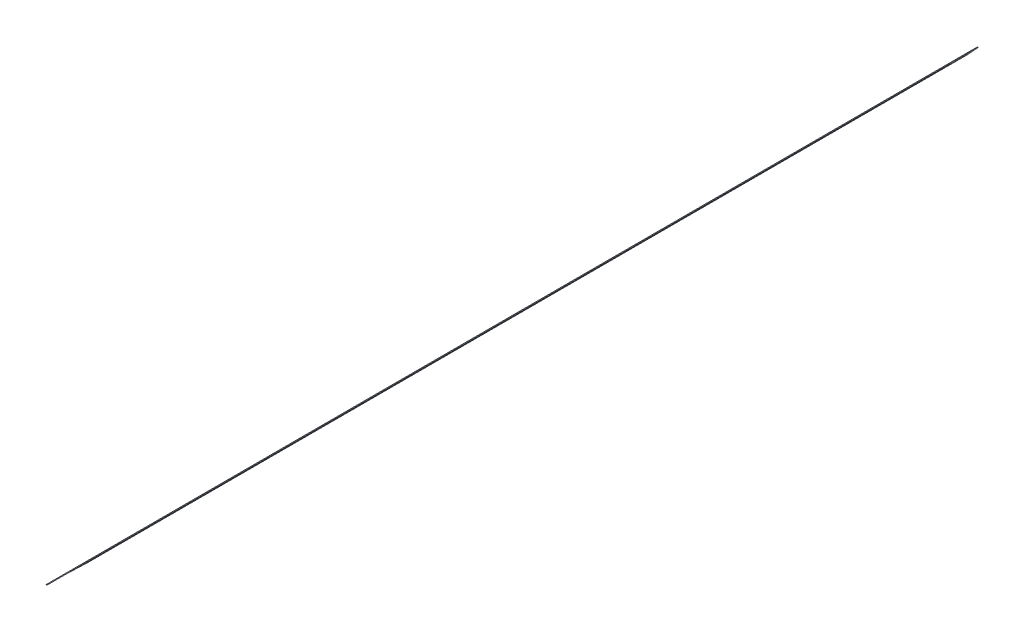
from build123d import *

# Parameters (mm, degrees)
BOSS_EXTRUDE1_DEPTH = 6.5
BOSS_EXTRUDE4_DEPTH = 254


with BuildPart() as part:
    # Sketch1 → Boss-Extrude1 (new body)
    with BuildSketch(Plane.XY):
        Polygon((0.098994949, 0), (-0.098994949, 0), (4.143645738, 4.242640687), (4.242640687, 4.143645738), align=None)
    extrude(amount=BOSS_EXTRUDE1_DEPTH)

    # Sketch2 → Loft1 section 0
    with BuildSketch(Plane(origin=(4.193143212, 4.193143212, 0), x_dir=(0, 0, -1), z_dir=(0.707106781186551, 0.7071067811865441, 0))):
        with BuildLine():
            Line((0, -0.07), (0, 0.07))
            Line((0, 0.07), (-6.5, 0.07))
            Line((-6.5, 0.07), (-6.5, -0.07))
            Line((-6.5, -0.07), (0, -0.07))
        make_face()
    # Sketch3 for Loft1 → Loft1 section 1
    with BuildSketch(Plane(origin=(6.314463556, 6.314463556, 0), x_dir=(0, 0, -1), z_dir=(0.7071067811865509, 0.7071067811865441, 0))):
        with BuildLine():
            Line((-6.5, 0.07), (-6.5, -0.070518608))
            # circular arc as an exact rational Bezier (weights 1, cos(half-angle), 1)
            Bezier((-6.5, -0.070518608), (-3.25, -0.349996161), (0, -0.070518608), weights=[1, 0.996322975, 1])
            Line((0, -0.070518608), (0, 0.07))
            Bezier((0, 0.07), (-3.25, -0.21052054), (-6.5, 0.07), weights=[1, 0.996295631, 1])
        make_face()
    loft()

    # Sketch6 → Boss-Extrude4 (add)
    with BuildSketch(Plane(origin=(6.314463556, 6.314463556, 0), x_dir=(0, 0, -1), z_dir=(0.7071067811865509, 0.7071067811865441, 0))):
        with BuildLine():
            Line((-6.5, 0.07), (-6.5, -0.070518608))
            ThreePointArc((-6.5, -0.070518608), (-3.25, -0.21), (0, -0.070518608))
            Line((0, -0.070518608), (0, 0.07))
            ThreePointArc((0, 0.07), (-3.25, -0.07), (-6.5, 0.07))
        make_face()
    extrude(amount=BOSS_EXTRUDE4_DEPTH)


solid = part.part
